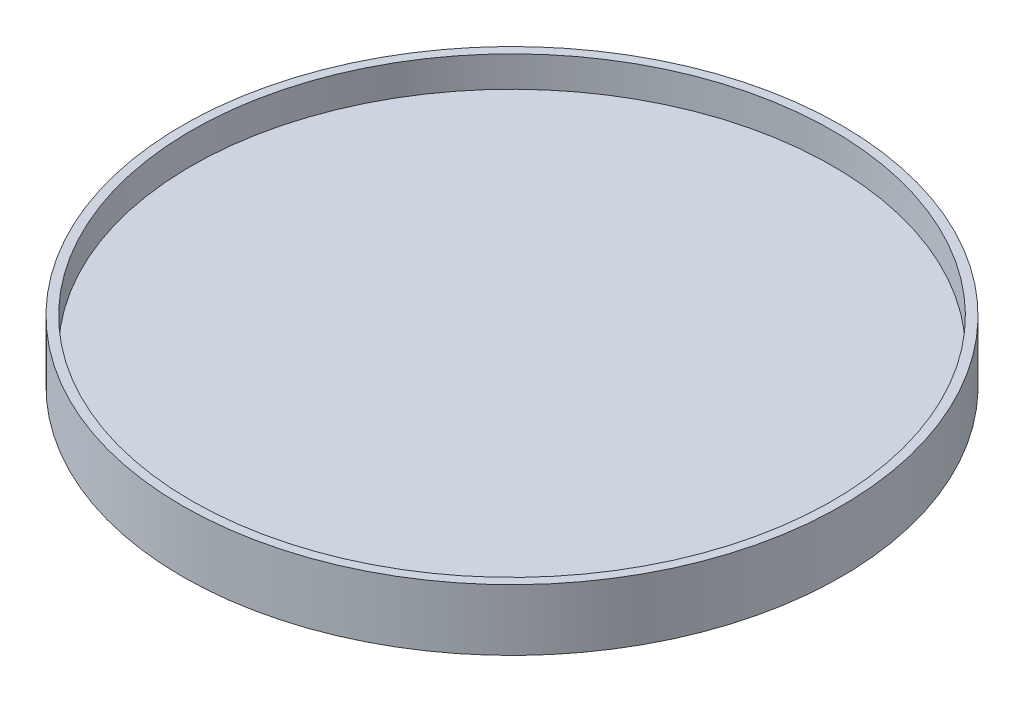
from build123d import *

# Parameters (mm, degrees)
SKETCH1_R           = 34.1376
BOSS_EXTRUDE1_DEPTH = 6.35
SKETCH2_R           = 33.2105
CUT_EXTRUDE3_DEPTH  = 3.175


with BuildPart() as part:
    # Sketch1 → Boss-Extrude1 (new body)
    with BuildSketch(Plane(origin=(0, 0, 0), x_dir=(1, 0, 0), z_dir=(0, 1, 0))):
        Circle(SKETCH1_R)
    extrude(amount=BOSS_EXTRUDE1_DEPTH)

    # Sketch2 → Cut-Extrude3 (cut)
    with BuildSketch(Plane(origin=(0, 6.35, 0), x_dir=(1, 0, 0), z_dir=(0, 1, 0))):
        Circle(SKETCH2_R)
    extrude(amount=-CUT_EXTRUDE3_DEPTH, mode=Mode.SUBTRACT)


solid = part.part
